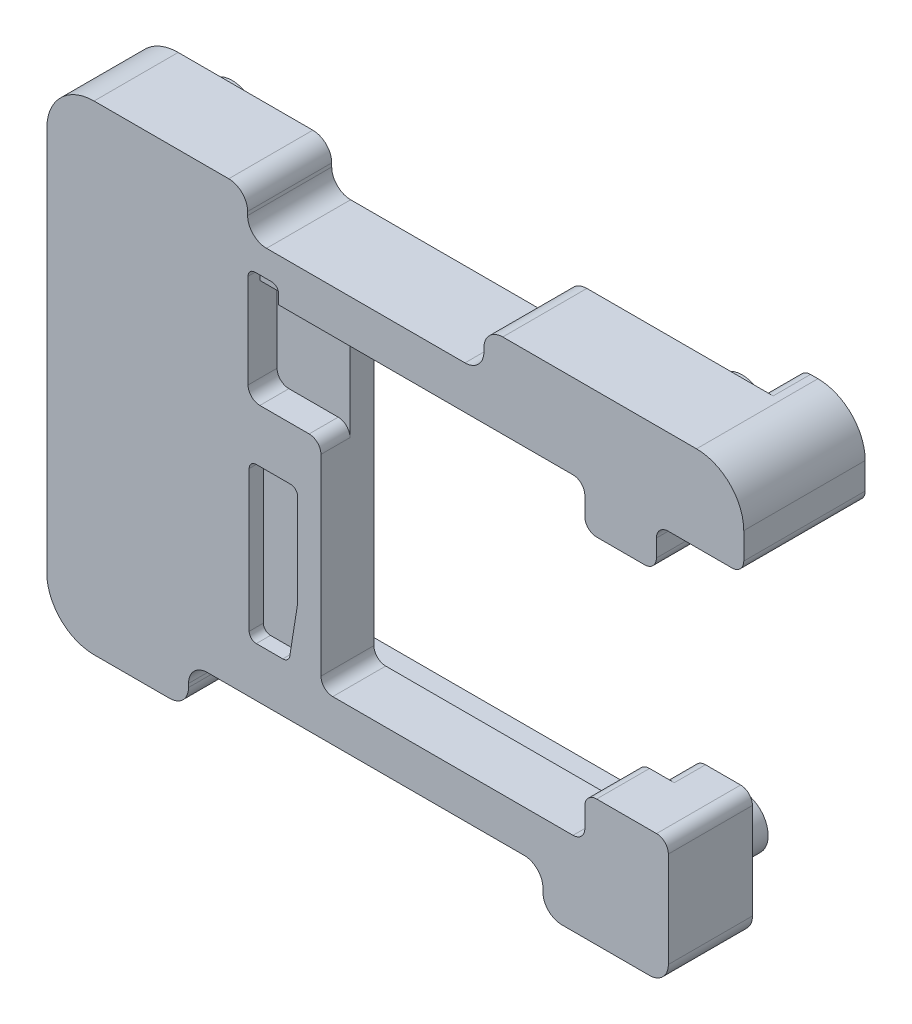
from build123d import *

# Parameters (mm, degrees)
EXTRUDE_1_DEPTH           = 2.44
OTHER_START               = -2.44
OTHER_1_DEPTH             = 1.32
OTHER_START_2             = -1.12
OTHER_1_2_OUTLINE_W       = 8.29964899
OTHER_1_2_OUTLINE_H       = 4.13786738
OTHER_1_2_DEPTH           = 1.12
CUT_EXTRUDE_1_DEPTH       = 1.32
SKETCH_3_W                = 8.69964899
SKETCH_3_H                = 4.53786738
CUT_EXTRUDE_2_DEPTH       = 1.12
CUT_EXTRUDE_3_DEPTH       = 0.4
SKETCH_5_W                = 15
SKETCH_5_H                = 3.5
SKETCH_5_W_2              = 10
CUT_EXTRUDE_4_DEPTH       = 34.841566158
FILLET_1_R                = 0.8
FILLET_2_R                = 0.8
SKETCH_6_W                = 4.08
SKETCH_6_H                = 9.6
CUT_EXTRUDE_5_DEPTH       = 3.8
SKETCH_7_W                = 11.168406503
SKETCH_7_H                = 13.214051925
CUT_EXTRUDE_6_DEPTH       = 34.841566158
CUT_EXTRUDE_7_DEPTH       = 1.32
SKETCH_10_W               = 11.168406503
SKETCH_10_H               = 13.214051925
EXTRUDE_2_DEPTH           = 1.52
EXTRUDE_START             = -5.14
EXTRUDE_3_DEPTH           = 5.14
SKETCH_12_W               = 2.24
SKETCH_12_H               = 9.6
CUT_EXTRUDE_8_DEPTH       = 0.42727367
FILLET_3_R                = 2
CUT_EXTRUDE_9_DEPTH       = 1.58
FILLET_4_R                = 0.5
OTHER_START_3             = 0.66
OTHER_2_OUTLINE_W         = 1.201543901
OTHER_2_OUTLINE_H         = 1.909822412
OTHER_2_OUTLINE_W_2       = 2.863837954
OTHER_2_OUTLINE_H_2       = 3.684536573
OTHER_2_OUTLINE_W_3       = 1.320722759
OTHER_2_OUTLINE_H_3       = 1.348576416
OTHER_2_OUTLINE_W_4       = 1.751728556
OTHER_2_OUTLINE_H_4       = 3.911393899
OTHER_2_OUTLINE_W_5       = 2.567505851
OTHER_2_OUTLINE_H_5       = 1.451984885
OTHER_2_DEPTH             = 0.46
OTHER_START_4             = 0.09
OTHER_2_2_OUTLINE_W       = 2.863837954
OTHER_2_2_OUTLINE_H       = 3.684536573
OTHER_2_2_DEPTH           = 0.57
OTHER_START_5             = 0.26
OTHER_2_3_OUTLINE_W       = 1.320722759
OTHER_2_3_OUTLINE_H       = 1.348576416
OTHER_2_3_DEPTH           = 0.4
OTHER_START_6             = 0.68
OTHER_2_4_OUTLINE_W       = 0.666899611
OTHER_2_4_OUTLINE_H       = 1.198197092
OTHER_2_4_DEPTH           = 0.44
OTHER_START_7             = 0.62
OTHER_2_5_OUTLINE_W       = 1.201543901
OTHER_2_5_OUTLINE_H       = 1.909822412
OTHER_2_5_OUTLINE_W_2     = 2.567505851
OTHER_2_5_OUTLINE_H_2     = 1.451984885
OTHER_2_5_DEPTH           = 0.04
OTHER_START_8             = 0.6
OTHER_2_6_OUTLINE_W       = 2.567505851
OTHER_2_6_OUTLINE_H       = 1.451984885
OTHER_2_6_DEPTH           = 0.02
CUT_EXTRUDE_10_DEPTH      = 37.044862325
CUT_EXTRUDE_10_DEPTH_BACK = 0.2
SKETCH_14_W               = 3.678796826
SKETCH_14_H               = 4.084536573
CUT_EXTRUDE_11_DEPTH      = 0.6
SKETCH_15_3_W             = 3.192025624
SKETCH_15_3_H             = 1.781419221
SKETCH_15_3_W_2           = 3.696451697
SKETCH_15_3_H_2           = 1.732632704
CUT_EXTRUDE_12_DEPTH      = 37.17678261
FILLET_5_R                = 0.5
FILLET_6_R                = 0.5
FILLET_7_R                = 0.5
FILLET_8_R                = 0.5
FILLET_9_R                = 0.3
CUT_EXTRUDE_START         = -0.19
CUT_EXTRUDE_13_DEPTH      = 0.19
SKETCH_16_R               = 1.1
EXTRUDE_4_DEPTH           = 1.58
SKETCH_20_W               = 10
SKETCH_20_H               = 5
CUT_EXTRUDE_14_DEPTH      = 37.17678261
FILLET_10_R               = 0.8
SKETCH_21_W               = 1.3
SKETCH_21_H               = 1.2
CUT_EXTRUDE_15_DEPTH      = 0.5
FILLET_11_R               = 0.3
SKETCH_22_W               = 0.5
SKETCH_22_H               = 0.5
CUT_EXTRUDE_16_DEPTH      = 0.73


# Read off the part's stored shape, not the designer's step: 型腔1, 型腔2
with BuildPart() as part:
    # 草图1 → 凸台-拉伸1 (new body)
    with BuildSketch(Plane.XY):
        with BuildLine():
            Line((2, 0), (25, 0))
            ThreePointArc((25, 0), (26.414213562, 0.585786438), (27, 2))
            Line((27, 2), (27, 18.3))
            ThreePointArc((27, 18.3), (26.414213562, 19.714213562), (25, 20.3))
            Line((25, 20.3), (2, 20.3))
            ThreePointArc((2, 20.3), (0.585786438, 19.714213562), (0, 18.3))
            Line((0, 18.3), (0, 2))
            ThreePointArc((0, 2), (0.585786438, 0.585786438), (2, 0))
        make_face()
    extrude(amount=-EXTRUDE_1_DEPTH)

    # 型腔1 outline → 型腔1 (cut)
    with BuildSketch(Plane.XY.offset(OTHER_START)):
        Polygon((20.76718246, 17.45363706), (6.031431818, 17.45363706), (3.097926023, 14.520131265), (1.253139238, 14.520131265), (1.253139238, 9.457591656), (2.972405574, 7.73832532), (2.972405574, 5.328306598), (5.105698603, 3.19501357), (21.79210044, 3.19501357), (23.620600297, 5.023513426), (23.620600297, 14.600219223), align=None)
    extrude(amount=OTHER_1_DEPTH, mode=Mode.SUBTRACT)

    # Other 1 2 outline → Other 1 2 (cut)
    with BuildSketch(Plane.XY.offset(OTHER_START_2)):
        with Locations((6.149824495, 11.9269807)):
            Rectangle(OTHER_1_2_OUTLINE_W, OTHER_1_2_OUTLINE_H)
    extrude(amount=OTHER_1_2_DEPTH, mode=Mode.SUBTRACT)

    # 草图2 → 切除-拉伸1 (cut)
    with BuildSketch(Plane(origin=(0, 0, -2.44), x_dir=(-1, 0, 0), z_dir=(0, 0, -1))):
        Polygon((-20.850025173, 17.65363706), (-23.820600297, 14.683061935), (-23.820600297, 4.940670714), (-21.874943153, 2.99501357), (-5.02285589, 2.99501357), (-2.772405574, 5.245463886), (-2.772405574, 7.655482608), (-1.053139238, 9.374748944), (-1.053139238, 14.720131265), (-3.01508331, 14.720131265), (-5.948589105, 17.65363706), align=None)
    extrude(amount=-CUT_EXTRUDE_1_DEPTH, mode=Mode.SUBTRACT)

    # 草图3 → 切除-拉伸2 (cut)
    with BuildSketch(Plane(origin=(0, 0, -1.12), x_dir=(-1, 0, 0), z_dir=(0, 0, -1))):
        with Locations((-6.149824495, 11.9269807)):
            Rectangle(SKETCH_3_W, SKETCH_3_H)
    extrude(amount=-CUT_EXTRUDE_2_DEPTH, mode=Mode.SUBTRACT)

    # 草图4 → 切除-拉伸3 (cut)
    with BuildSketch(Plane.XY):
        with BuildLine():
            Line((2, 0), (25, 0))
            ThreePointArc((25, 0), (26.414213562, 0.585786438), (27, 2))
            Line((27, 2), (27, 18.3))
            ThreePointArc((27, 18.3), (26.414213562, 19.714213562), (25, 20.3))
            Line((25, 20.3), (2, 20.3))
            ThreePointArc((2, 20.3), (0.585786438, 19.714213562), (0, 18.3))
            Line((0, 18.3), (0, 2))
            ThreePointArc((0, 2), (0.585786438, 0.585786438), (2, 0))
        make_face()
    extrude(amount=-CUT_EXTRUDE_3_DEPTH, mode=Mode.SUBTRACT)

    # 草图5 → 切除-拉伸4 (cut, through all)
    with BuildSketch(Plane.XY.offset(-0.4)):
        with Locations((13.5, 0)):
            Rectangle(SKETCH_5_W, SKETCH_5_H)
        with Locations((13.5, 20.3)):
            Rectangle(SKETCH_5_W_2, SKETCH_5_H)
    extrude(amount=-CUT_EXTRUDE_4_DEPTH, mode=Mode.SUBTRACT)

    # 圆角1
    fillet_1_edges = [part.edges().sort_by_distance(p)[0] for p in [
        (21, 1.75, -1.42),
        (6, 1.75, -1.42),
        (18.5, 18.55, -1.42),
        (8.5, 18.55, -1.42),
    ]]
    fillet(fillet_1_edges, radius=FILLET_1_R)

    # 圆角2
    fillet_2_edges = [part.edges().sort_by_distance(p)[0] for p in [
        (21, 0, -1.42),
        (6, 0, -1.42),
        (18.5, 20.3, -1.42),
        (8.5, 20.3, -1.42),
    ]]
    fillet(fillet_2_edges, radius=FILLET_2_R)

    # 草图6 → 切除-拉伸5 (cut)
    with BuildSketch(Plane(origin=(27, 0, 0), x_dir=(0, 0, -1), z_dir=(1, 0, 0))):
        with Locations((0.4, 10.15)):
            Rectangle(SKETCH_6_W, SKETCH_6_H)
    extrude(amount=-CUT_EXTRUDE_5_DEPTH, mode=Mode.SUBTRACT)

    # 草图7 → 切除-拉伸6 (cut, through all)
    with BuildSketch(Plane.XY.offset(-0.4)):
        with Locations((17.188523079, 10.125606742)):
            Rectangle(SKETCH_7_W, SKETCH_7_H)
    extrude(amount=-CUT_EXTRUDE_6_DEPTH, mode=Mode.SUBTRACT)

    # 草图9 → 切除-拉伸7 (cut)
    with BuildSketch(Plane(origin=(0, 0, -2.44), x_dir=(-1, 0, 0), z_dir=(0, 0, -1))):
        Polygon((-21.874943153, 2.99501357), (-22.320600297, 2.99501357), (-23.820600297, 4.49501357), (-23.820600297, 16.15363706), (-22.320600297, 17.65363706), (-20.850025173, 17.65363706), align=None)
    extrude(amount=-CUT_EXTRUDE_7_DEPTH, mode=Mode.SUBTRACT)

    # 草图10 → 凸台-拉伸2 (add)
    with BuildSketch(Plane.XY.offset(-0.4)):
        with BuildLine():
            Line((27, 5.35), (23.2, 5.35))
            Line((23.2, 5.35), (23.2, 14.95))
            Line((23.2, 14.95), (27, 14.95))
            Line((27, 14.95), (27, 18.3))
            ThreePointArc((27, 18.3), (26.414213562, 19.714213562), (25, 20.3))
            Line((25, 20.3), (19.3, 20.3))
            ThreePointArc((19.3, 20.3), (18.734314575, 20.065685425), (18.5, 19.5))
            Line((18.5, 19.5), (18.5, 19.35))
            ThreePointArc((18.5, 19.35), (18.265685425, 18.784314575), (17.7, 18.55))
            Line((17.7, 18.55), (9.3, 18.55))
            ThreePointArc((9.3, 18.55), (8.734314575, 18.784314575), (8.5, 19.35))
            Line((8.5, 19.35), (8.5, 19.5))
            ThreePointArc((8.5, 19.5), (8.265685425, 20.065685425), (7.7, 20.3))
            Line((7.7, 20.3), (2, 20.3))
            ThreePointArc((2, 20.3), (0.585786438, 19.714213562), (0, 18.3))
            Line((0, 18.3), (0, 2))
            ThreePointArc((0, 2), (0.585786438, 0.585786438), (2, 0))
            Line((2, 0), (5.2, 0))
            ThreePointArc((5.2, 0), (5.765685425, 0.234314575), (6, 0.8))
            Line((6, 0.8), (6, 0.95))
            ThreePointArc((6, 0.95), (6.234314575, 1.515685425), (6.8, 1.75))
            Line((6.8, 1.75), (20.2, 1.75))
            ThreePointArc((20.2, 1.75), (20.765685425, 1.515685425), (21, 0.95))
            Line((21, 0.95), (21, 0.8))
            ThreePointArc((21, 0.8), (21.234314575, 0.234314575), (21.8, 0))
            Line((21.8, 0), (25, 0))
            ThreePointArc((25, 0), (26.414213562, 0.585786438), (27, 2))
            Line((27, 2), (27, 5.35))
        make_face()
        with Locations((17.188523079, 10.125606742)):
            Rectangle(SKETCH_10_W, SKETCH_10_H, mode=Mode.SUBTRACT)
    extrude(amount=EXTRUDE_2_DEPTH)

    # 草图11 → 凸台-拉伸3 (add)
    with BuildSketch(Plane.XY.offset(1.12).offset(EXTRUDE_START)):
        with BuildLine():
            Line((27, 14.95), (29.5, 14.95))
            Line((29.5, 14.95), (29.5, 20.3))
            Line((29.5, 20.3), (25, 20.3))
            ThreePointArc((25, 20.3), (26.414213562, 19.714213562), (27, 18.3))
            Line((27, 18.3), (27, 14.95))
        make_face()
        with BuildLine():
            Line((27, 5.35), (29.5, 5.35))
            Line((29.5, 5.35), (29.5, 0))
            Line((29.5, 0), (25, 0))
            ThreePointArc((25, 0), (26.414213562, 0.585786438), (27, 2))
            Line((27, 2), (27, 5.35))
        make_face()
    extrude(amount=EXTRUDE_3_DEPTH)

    # 草图12 → 切除-拉伸8 (cut)
    with BuildSketch(Plane(origin=(23.2, 0, 0), x_dir=(0, 0, -1), z_dir=(1, 0, 0))):
        with Locations((0, 10.15)):
            Rectangle(SKETCH_12_W, SKETCH_12_H)
    extrude(amount=-CUT_EXTRUDE_8_DEPTH, mode=Mode.SUBTRACT)

    # 圆角3
    fillet_3_edges = [part.edges().sort_by_distance(p)[0] for p in [
        (29.5, 20.3, -1.45),
        (29.5, 0, -1.45),
    ]]
    fillet(fillet_3_edges, radius=FILLET_3_R)

    # 草图13 → 切除-拉伸9 (cut)
    with BuildSketch(Plane(origin=(0, 0, -4.02), x_dir=(-1, 0, 0), z_dir=(0, 0, -1))):
        with BuildLine():
            Line((-27.15, 18.3), (-27.15, 14.95))
            Line((-27.15, 14.95), (-27.15, 5.35))
            Line((-27.15, 5.35), (-27.15, 2))
            ThreePointArc((-27.15, 2), (-26.52027958, 0.47972042), (-25, -0.15))
            Line((-25, -0.15), (-25, 20.45))
            ThreePointArc((-25, 20.45), (-26.52027958, 19.82027958), (-27.15, 18.3))
        make_face()
    extrude(amount=-CUT_EXTRUDE_9_DEPTH, mode=Mode.SUBTRACT)

    # 圆角4
    fillet_4_edges = [part.edges().sort_by_distance(p)[0] for p in [
        (25.788986692, 20.3, -3.23),
        (25.788986692, 0, -3.23),
    ]]
    fillet(fillet_4_edges, radius=FILLET_4_R)

    # 型腔2 outline → 型腔2 (cut)
    with BuildSketch(Plane.XY.offset(OTHER_START_3)):
        with Locations((9.494364731, 4.948898)):
            Rectangle(OTHER_2_OUTLINE_W, OTHER_2_OUTLINE_H)
        with Locations((10.148694075, 14.690364417)):
            Rectangle(OTHER_2_OUTLINE_W_2, OTHER_2_OUTLINE_H_2)
        with Locations((26.613909683, 15.858344496)):
            Rectangle(OTHER_2_OUTLINE_W_3, OTHER_2_OUTLINE_H_3)
        with Locations((9.592639376, 8.304973628)):
            Rectangle(OTHER_2_OUTLINE_W_4, OTHER_2_OUTLINE_H_4)
        with Locations((27.741727302, 4.444573222)):
            Rectangle(OTHER_2_OUTLINE_W_5, OTHER_2_OUTLINE_H_5)
    extrude(amount=OTHER_2_DEPTH, mode=Mode.SUBTRACT)

    # Other 2 2 outline → Other 2 2 (cut)
    with BuildSketch(Plane.XY.offset(OTHER_START_4)):
        with Locations((10.148694075, 14.690364417)):
            Rectangle(OTHER_2_2_OUTLINE_W, OTHER_2_2_OUTLINE_H)
    extrude(amount=OTHER_2_2_DEPTH, mode=Mode.SUBTRACT)

    # Other 2 3 outline → Other 2 3 (cut)
    with BuildSketch(Plane.XY.offset(OTHER_START_5)):
        with Locations((26.613909683, 15.858344496)):
            Rectangle(OTHER_2_3_OUTLINE_W, OTHER_2_3_OUTLINE_H)
    extrude(amount=OTHER_2_3_DEPTH, mode=Mode.SUBTRACT)

    # Other 2 4 outline → Other 2 4 (cut)
    with BuildSketch(Plane.XY.offset(OTHER_START_6)):
        with Locations((28.882676006, 15.933534158)):
            Rectangle(OTHER_2_4_OUTLINE_W, OTHER_2_4_OUTLINE_H)
    extrude(amount=OTHER_2_4_DEPTH, mode=Mode.SUBTRACT)

    # Other 2 5 outline → Other 2 5 (cut)
    with BuildSketch(Plane.XY.offset(OTHER_START_7)):
        with Locations((9.494364731, 4.948898)):
            Rectangle(OTHER_2_5_OUTLINE_W, OTHER_2_5_OUTLINE_H)
        with Locations((27.741727302, 4.444573222)):
            Rectangle(OTHER_2_5_OUTLINE_W_2, OTHER_2_5_OUTLINE_H_2)
    extrude(amount=OTHER_2_5_DEPTH, mode=Mode.SUBTRACT)

    # Other 2 6 outline → Other 2 6 (cut)
    with BuildSketch(Plane.XY.offset(OTHER_START_8)):
        with Locations((27.741727302, 4.444573222)):
            Rectangle(OTHER_2_6_OUTLINE_W, OTHER_2_6_OUTLINE_H)
    extrude(amount=OTHER_2_6_DEPTH, mode=Mode.SUBTRACT)

    # 草图14 → 切除-拉伸10 (cut, two sides: drawn at the far end of the back side and taken through both)
    with BuildSketch(Plane.XY.offset(0.09).offset(-CUT_EXTRUDE_10_DEPTH_BACK)):
        with Locations((10.356173511, 14.690364417)):
            Rectangle(SKETCH_14_W, SKETCH_14_H)
    extrude(amount=CUT_EXTRUDE_10_DEPTH + CUT_EXTRUDE_10_DEPTH_BACK, mode=Mode.SUBTRACT)

    # 草图15 → 切除-拉伸11 (cut)
    with BuildSketch(Plane.XY.offset(1.12)):
        Polygon((10.618503654, 10.410670577), (8.566775098, 10.410670577), (8.566775098, 6.199276678), (8.566775098, 3.843986794), (8.74359278, 3.843986794), (10.245136681, 3.843986794), (10.618503654, 6.199276678), align=None)
    extrude(amount=-CUT_EXTRUDE_11_DEPTH, mode=Mode.SUBTRACT)

    # 草图15<3> → 切除-拉伸12 (cut, through all)
    with BuildSketch(Plane.XY.offset(1.12)):
        with Locations((27.903987188, 4.45929039)):
            Rectangle(SKETCH_15_3_W, SKETCH_15_3_H)
        with Locations((27.651774152, 15.816316352)):
            Rectangle(SKETCH_15_3_W_2, SKETCH_15_3_H_2)
    extrude(amount=-CUT_EXTRUDE_12_DEPTH, mode=Mode.SUBTRACT)

    # 圆角5
    fillet_5_edges = [part.edges().sort_by_distance(p)[0] for p in [
        (5.948589105, 17.65363706, -1.78),
        (3.01508331, 14.720131265, -1.78),
        (1.053139238, 14.720131265, -1.78),
        (1.053139238, 9.374748944, -1.78),
        (25.803548303, 16.682632704, -0.66),
        (29.5, 16.682632704, -1.45),
        (26.307974376, 3.568580779, -0.66),
        (29.5, 3.568580779, -1.45),
    ]]
    fillet(fillet_5_edges, radius=FILLET_5_R)

    # 圆角6
    fillet_6_edges = [part.edges().sort_by_distance(p)[0] for p in [
        (2.772405574, 7.655482608, -1.78),
        (2.772405574, 5.245463886, -1.78),
        (5.02285589, 2.99501357, -1.78),
        (23.820600297, 5.35, -1.78),
        (23.820600297, 14.95, -1.78),
        (23.820600297, 4.49501357, -1.78),
        (22.320600297, 2.99501357, -1.78),
        (23.820600297, 16.15363706, -1.78),
        (22.320600297, 17.65363706, -1.78),
        (27.15, 16.682632704, -3.23),
        (27.15, 3.568580779, -3.23),
        (25.803548303, 14.95, -0.66),
        (26.307974376, 5.35, -0.66),
    ]]
    fillet(fillet_6_edges, radius=FILLET_6_R)

    # 圆角7
    fillet_7_edges = [part.edges().sort_by_distance(p)[0] for p in [
        (10.49964899, 9.65804701, -0.76),
        (1.8, 9.65804701, -0.76),
        (10.49964899, 14.19591439, -0.76),
        (1.8, 14.19591439, -0.76),
    ]]
    fillet(fillet_7_edges, radius=FILLET_7_R)

    # 圆角8
    fillet_8_edges = [part.edges().sort_by_distance(p)[0] for p in [
        (11.604319827, 3.518580779, 0),
        (22.77272633, 16.732632704, 0),
        (22.77272633, 3.518580779, 0),
        (22.77272633, 5.35, 0),
        (22.77272633, 14.95, 0),
        (11.604319827, 12.648096131, 0.505),
        (8.516775098, 12.648096131, 0.505),
        (8.516775098, 16.732632704, 0.505),
    ]]
    fillet(fillet_8_edges, radius=FILLET_8_R)

    # 圆角9
    fillet_9_edges = [part.edges().sort_by_distance(p)[0] for p in [
        (8.566775098, 10.410670577, 0.82),
        (10.618503654, 10.410670577, 0.82),
        (10.618503654, 6.199276678, 0.82),
        (10.245136681, 3.843986794, 0.82),
        (8.566775098, 3.843986794, 0.82),
    ]]
    fillet(fillet_9_edges, radius=FILLET_9_R)

    # 草图19 → 切除-拉伸13 (cut)
    with BuildSketch(Plane(origin=(0, 0, -0.4), x_dir=(-1, 0, 0), z_dir=(0, 0, -1)).offset(CUT_EXTRUDE_START)):
        with BuildLine():
            Line((-2.3, 14.19591439), (-9.99964899, 14.19591439))
            ThreePointArc((-9.99964899, 14.19591439), (-10.35320238, 14.049467781), (-10.49964899, 13.69591439))
            Line((-10.49964899, 13.69591439), (-10.49964899, 10.15804701))
            ThreePointArc((-10.49964899, 10.15804701), (-10.35320238, 9.80449362), (-9.99964899, 9.65804701))
            Line((-9.99964899, 9.65804701), (-2.3, 9.65804701))
            ThreePointArc((-2.3, 9.65804701), (-1.946446609, 9.80449362), (-1.8, 10.15804701))
            Line((-1.8, 10.15804701), (-1.8, 13.69591439))
            ThreePointArc((-1.8, 13.69591439), (-1.946446609, 14.049467781), (-2.3, 14.19591439))
        make_face()
    extrude(amount=CUT_EXTRUDE_13_DEPTH, mode=Mode.SUBTRACT)

    # 草图16 → 凸台-拉伸4 (add)
    with BuildSketch(Plane(origin=(0, 0, -2.44), x_dir=(-1, 0, 0), z_dir=(0, 0, -1))):
        with Locations(Location((-2.702523757, 17.738432958, 0), (0, 0, 180))):
            Circle(SKETCH_16_R)
        with Locations(Location((-24.292523757, 17.738432958, 0), (0, 0, 180))):
            Circle(SKETCH_16_R)
        with Locations(Location((-24.292523757, 2.498432958, 0), (0, 0, 180))):
            Circle(SKETCH_16_R)
        with Locations(Location((-2.702523757, 2.498432958, 0), (0, 0, 180))):
            Circle(SKETCH_16_R)
    extrude(amount=EXTRUDE_4_DEPTH)

    # 草图20 → 切除-拉伸14 (cut, through all)
    with BuildSketch(Plane.XY.offset(1.12)):
        with Locations((31.307974376, 1.568580779)):
            Rectangle(SKETCH_20_W, SKETCH_20_H)
    extrude(amount=-CUT_EXTRUDE_14_DEPTH, mode=Mode.SUBTRACT)

    # 圆角10
    fillet_10_edges = [part.edges().sort_by_distance(p)[0] for p in [
        (26.307974376, 0, -0.66),
    ]]
    fillet(fillet_10_edges, radius=FILLET_10_R)

    # 草图21 → 切除-拉伸15 (cut)
    with BuildSketch(Plane.XY.offset(1.12)):
        with Locations((9.166775098, 16.832632704)):
            Rectangle(SKETCH_21_W, SKETCH_21_H)
    extrude(amount=-CUT_EXTRUDE_15_DEPTH, mode=Mode.SUBTRACT)

    # 圆角11
    fillet_11_edges = [part.edges().sort_by_distance(p)[0] for p in [
        (9.816775098, 17.432632704, 0.87),
        (8.516775098, 17.432632704, 0.87),
    ]]
    fillet(fillet_11_edges, radius=FILLET_11_R)

    # 草图22 → 切除-拉伸16 (cut)
    with BuildSketch(Plane.XY.offset(0.62)):
        with Locations((8.766775098, 16.482632704)):
            Rectangle(SKETCH_22_W, SKETCH_22_H)
    extrude(amount=-CUT_EXTRUDE_16_DEPTH, mode=Mode.SUBTRACT)


solid = part.part
